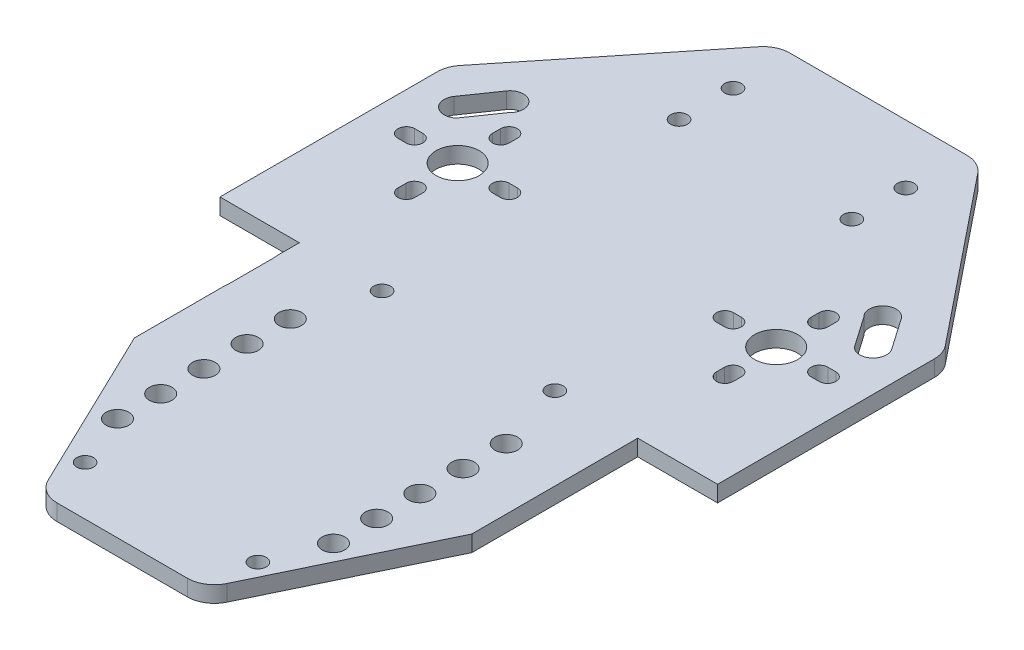
from build123d import *

# Parameters (mm, degrees)
SKETCH1_2_R         = 1.55
SKETCH1_2_R_2       = 2.1
SKETCH1_2_R_3       = 4
EXTRUDE_1_DEPTH     = 3
CUT_EXTRUDE_1_DEPTH = 103.641715784
FILLET_1_R          = 5


with BuildPart() as part:
    # Sketch1<2> → 凸台-拉伸1 (new body)
    with BuildSketch(Plane(origin=(0, 0, 0), x_dir=(1, 0, 0), z_dir=(0, 1, 0))):
        Polygon((46.148756691, -91.633040301), (46, 48.415898807), (-46, 48.415898807), (-46.148704625, -91.584022218), align=None)
        with Locations((-16, -82.5)):
            Circle(SKETCH1_2_R, mode=Mode.SUBTRACT)
        with Locations((-20, -72.5)):
            Circle(SKETCH1_2_R_2, mode=Mode.SUBTRACT)
        with Locations((-20, -64.5)):
            Circle(SKETCH1_2_R_2, mode=Mode.SUBTRACT)
        with BuildLine():
            Line((-31.324560396, -32.437502342), (-31.324560396, -40.532123219))
            ThreePointArc((-31.324560396, -40.532123219), (-34.902584515, -44.110147338), (-38.480608633, -40.532123219))
            Line((-38.480608633, -40.532123219), (-38.480608633, -33.618273202))
            ThreePointArc((-38.480608633, -33.618273202), (-35.598368392, -28.811097573), (-31.324560396, -32.437502342))
        make_face(mode=Mode.SUBTRACT)
        with Locations((-20, -56.5)):
            Circle(SKETCH1_2_R_2, mode=Mode.SUBTRACT)
        with Locations((-20, -48.5)):
            Circle(SKETCH1_2_R_2, mode=Mode.SUBTRACT)
        with Locations((-20, -40.5)):
            Circle(SKETCH1_2_R_2, mode=Mode.SUBTRACT)
        with Locations((-16, -27.5)):
            Circle(SKETCH1_2_R, mode=Mode.SUBTRACT)
        with Locations((16, -82.5)):
            Circle(SKETCH1_2_R, mode=Mode.SUBTRACT)
        with Locations((20, -72.5)):
            Circle(SKETCH1_2_R_2, mode=Mode.SUBTRACT)
        with Locations((20, -64.5)):
            Circle(SKETCH1_2_R_2, mode=Mode.SUBTRACT)
        with Locations((20, -56.5)):
            Circle(SKETCH1_2_R_2, mode=Mode.SUBTRACT)
        with Locations((20, -48.5)):
            Circle(SKETCH1_2_R_2, mode=Mode.SUBTRACT)
        with Locations((20, -40.5)):
            Circle(SKETCH1_2_R_2, mode=Mode.SUBTRACT)
        with Locations((16, -27.5)):
            Circle(SKETCH1_2_R, mode=Mode.SUBTRACT)
        with BuildLine():
            ThreePointArc((38.480608633, -40.532123219), (34.902584515, -44.110147338), (31.324560396, -40.532123219))
            Line((31.324560396, -40.532123219), (31.324560396, -32.437502342))
            ThreePointArc((31.324560396, -32.437502342), (35.598368392, -28.811097573), (38.480608633, -33.618273202))
            Line((38.480608633, -33.618273202), (38.480608633, -40.532123219))
        make_face(mode=Mode.SUBTRACT)
        with BuildLine():
            Line((-31.05, -9.5), (-31.05, -8))
            ThreePointArc((-31.05, -8), (-29.5, -6.45), (-27.95, -8))
            Line((-27.95, -8), (-27.95, -9.5))
            ThreePointArc((-27.95, -9.5), (-29.5, -11.05), (-31.05, -9.5))
        make_face(mode=Mode.SUBTRACT)
        with BuildLine():
            Line((-39, 1.55), (-37.5, 1.55))
            ThreePointArc((-37.5, 1.55), (-35.95, 0), (-37.5, -1.55))
            Line((-37.5, -1.55), (-39, -1.55))
            ThreePointArc((-39, -1.55), (-40.55, 0), (-39, 1.55))
        make_face(mode=Mode.SUBTRACT)
        with BuildLine():
            Line((-32.838354936, 12.874839613), (-36.826644357, 7.122140465))
            ThreePointArc((-36.826644357, 7.122140465), (-40.125878325, 7.09368849), (-40.5284969, 10.368387343))
            Line((-40.5284969, 10.368387343), (-36.540207479, 16.121086492))
            ThreePointArc((-36.540207479, 16.121086492), (-32.870241162, 16.57230252), (-32.838354936, 12.874839613))
        make_face(mode=Mode.SUBTRACT)
        with Locations((-29.5, 0)):
            Circle(SKETCH1_2_R_3, mode=Mode.SUBTRACT)
        with BuildLine():
            Line((-27.95, 9.5), (-27.95, 8))
            ThreePointArc((-27.95, 8), (-29.5, 6.45), (-31.05, 8))
            Line((-31.05, 8), (-31.05, 9.5))
            ThreePointArc((-31.05, 9.5), (-29.5, 11.05), (-27.95, 9.5))
        make_face(mode=Mode.SUBTRACT)
        with BuildLine():
            Line((-20, -1.55), (-21.5, -1.55))
            ThreePointArc((-21.5, -1.55), (-23.05, 0), (-21.5, 1.55))
            Line((-21.5, 1.55), (-20, 1.55))
            ThreePointArc((-20, 1.55), (-18.45, 0), (-20, -1.55))
        make_face(mode=Mode.SUBTRACT)
        with Locations((-16, 27.5)):
            Circle(SKETCH1_2_R, mode=Mode.SUBTRACT)
        with Locations((-16, 37.5)):
            Circle(SKETCH1_2_R, mode=Mode.SUBTRACT)
        with BuildLine():
            ThreePointArc((21.5, 1.55), (23.05, 0), (21.5, -1.55))
            Line((21.5, -1.55), (20, -1.55))
            ThreePointArc((20, -1.55), (18.45, 0), (20, 1.55))
            Line((20, 1.55), (21.5, 1.55))
        make_face(mode=Mode.SUBTRACT)
        with BuildLine():
            ThreePointArc((27.95, -8), (29.5, -6.45), (31.05, -8))
            Line((31.05, -8), (31.05, -9.5))
            ThreePointArc((31.05, -9.5), (29.5, -11.05), (27.95, -9.5))
            Line((27.95, -9.5), (27.95, -8))
        make_face(mode=Mode.SUBTRACT)
        with Locations((29.5, 0)):
            Circle(SKETCH1_2_R_3, mode=Mode.SUBTRACT)
        with BuildLine():
            ThreePointArc((31.05, 8), (29.5, 6.45), (27.95, 8))
            Line((27.95, 8), (27.95, 9.5))
            ThreePointArc((27.95, 9.5), (29.5, 11.05), (31.05, 9.5))
            Line((31.05, 9.5), (31.05, 8))
        make_face(mode=Mode.SUBTRACT)
        with BuildLine():
            ThreePointArc((37.5, -1.55), (35.95, 0), (37.5, 1.55))
            Line((37.5, 1.55), (39, 1.55))
            ThreePointArc((39, 1.55), (40.55, 0), (39, -1.55))
            Line((39, -1.55), (37.5, -1.55))
        make_face(mode=Mode.SUBTRACT)
        with BuildLine():
            ThreePointArc((40.5284969, 10.368387343), (40.125878325, 7.09368849), (36.826644357, 7.122140465))
            Line((36.826644357, 7.122140465), (32.838354936, 12.874839613))
            ThreePointArc((32.838354936, 12.874839613), (32.870241162, 16.57230252), (36.540207479, 16.121086492))
            Line((36.540207479, 16.121086492), (40.5284969, 10.368387343))
        make_face(mode=Mode.SUBTRACT)
        with Locations((16, 27.5)):
            Circle(SKETCH1_2_R, mode=Mode.SUBTRACT)
        with Locations((16, 37.5)):
            Circle(SKETCH1_2_R, mode=Mode.SUBTRACT)
    extrude(amount=EXTRUDE_1_DEPTH)

    # 草图8 → 切除-拉伸1 (cut, through all)
    with BuildSketch(Plane(origin=(0, 0, 0), x_dir=(1, 0, 0), z_dir=(0, 1, 0))):
        Polygon((-60.581160188, -100.138876612), (-11.106907858, -100.138876612), (-31.388896544, -57.980337113), (-31.388896544, -27.441927357), (-46.0805744, -27.441927357), (-60.581160188, 2.69927468), align=None)
        Polygon((11.106907858, -100.138876612), (60.581160188, -100.138876612), (60.581160188, 2.69927468), (46.0805744, -27.441927357), (31.297190757, -27.441927357), (31.297190757, -58.170958562), align=None)
        Polygon((-55.547798239, 53.825279921), (-55.547798239, 2.686584408), (-14.43040337, 53.825279921), align=None)
        Polygon((55.547798239, 2.686584408), (55.547798239, 53.825279921), (14.43040337, 53.825279921), align=None)
    extrude(amount=CUT_EXTRUDE_1_DEPTH, mode=Mode.SUBTRACT)

    # 圆角1
    fillet_1_edges = [part.edges().sort_by_distance(p)[0] for p in [
        (-15.214646295, 1.5, 91.600450928),
        (15.206873585, 1.5, 91.616607436),
        (46.036007008, 1.5, -14.516628531),
        (18.779745038, 1.5, -48.415898807),
        (-18.779745038, 1.5, -48.415898807),
        (-46.036007008, 1.5, -14.516628531),
    ]]
    fillet(fillet_1_edges, radius=FILLET_1_R)


solid = part.part
